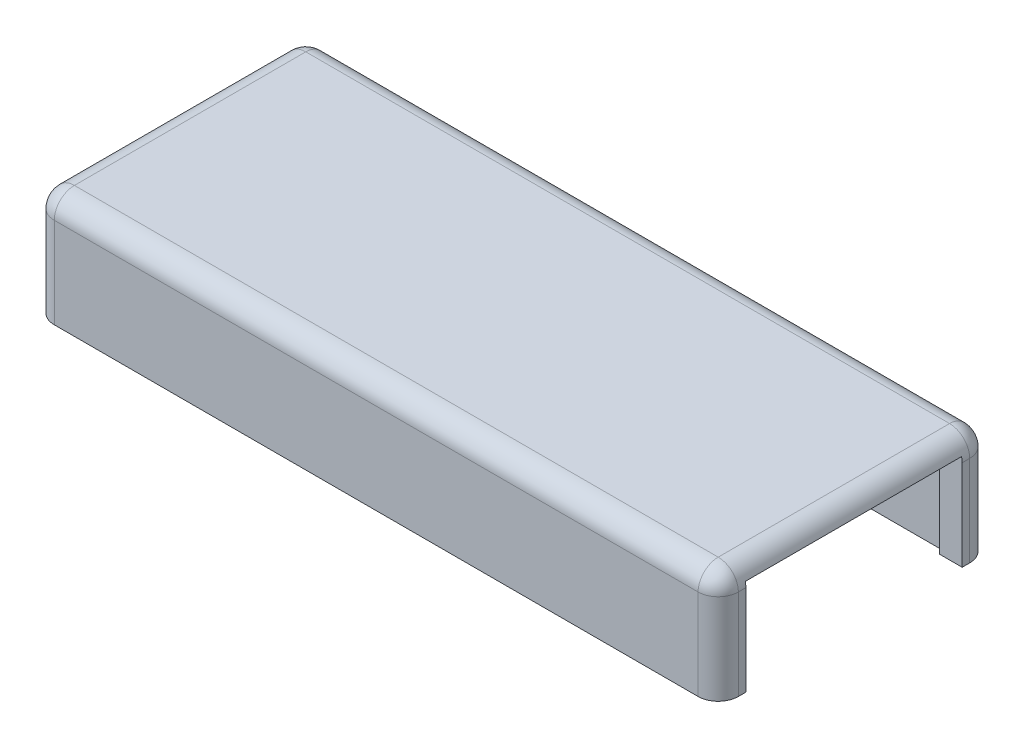
from build123d import *

# Parameters (mm, degrees)
SKETCH_1_W          = 68
SKETCH_1_H          = 27
EXTRUDE_1_DEPTH     = 11
SKETCH_2_W          = 63.5
SKETCH_2_H          = 22.5
CUT_EXTRUDE_1_DEPTH = 9.5
CUT_EXTRUDE_2_DEPTH = 2.25
SKETCH_4_W          = 21.5
SKETCH_4_H          = 9.5
CUT_EXTRUDE_3_DEPTH = 2.25
EXTRUDE_2_DEPTH     = 9.5
EXTRUDE_3_DEPTH     = 9.5
SKETCH_7_R          = 1
CUT_EXTRUDE_4_DEPTH = 9.5
FILLET_1_R          = 2


with BuildPart() as part:
    # Эскиз1 → Бобышка-Вытянуть1 (new body)
    with BuildSketch(Plane(origin=(0, 0, 0), x_dir=(1, 0, 0), z_dir=(0, 1, 0))):
        Rectangle(SKETCH_1_W, SKETCH_1_H)
    extrude(amount=EXTRUDE_1_DEPTH)

    # Эскиз2 → Вырез-Вытянуть1 (cut)
    with BuildSketch(Plane.XZ):
        Rectangle(SKETCH_2_W, SKETCH_2_H)
    extrude(amount=-CUT_EXTRUDE_1_DEPTH, mode=Mode.SUBTRACT)

    # Эскиз3 → Вырез-Вытянуть2 (cut)
    with BuildSketch(Plane.ZY.offset(34)):
        with BuildLine():
            Line((-4.6, 2.1), (-4.6, 0))
            Line((-4.6, 0), (4.6, 0))
            Line((4.6, 0), (4.6, 2.1))
            ThreePointArc((4.6, 2.1), (4.219238816, 3.019238816), (3.3, 3.4))
            Line((3.3, 3.4), (-3.3, 3.4))
            ThreePointArc((-3.3, 3.4), (-4.219238816, 3.019238816), (-4.6, 2.1))
        make_face()
    extrude(amount=-CUT_EXTRUDE_2_DEPTH, mode=Mode.SUBTRACT)

    # Эскиз4 → Вырез-Вытянуть3 (cut)
    with BuildSketch(Plane(origin=(34, 0, 0), x_dir=(0, 0, -1), z_dir=(1, 0, 0))):
        with Locations((0, 4.75)):
            Rectangle(SKETCH_4_W, SKETCH_4_H)
    extrude(amount=-CUT_EXTRUDE_3_DEPTH, mode=Mode.SUBTRACT)

    # Эскиз5 → Бобышка-Вытянуть2 (add)
    with BuildSketch(Plane.XZ.offset(-9.5)):
        with BuildLine():
            Line((-19.5, -9), (-19.5, -11.25))
            Line((-19.5, -11.25), (-23.5, -11.25))
            Line((-23.5, -11.25), (-23.5, -9))
            ThreePointArc((-23.5, -9), (-21.5, -7), (-19.5, -9))
        make_face()
        with BuildLine():
            Line((-23.5, 11.25), (-23.5, 9))
            ThreePointArc((-23.5, 9), (-21.5, 7), (-19.5, 9))
            Line((-19.5, 9), (-19.5, 11.25))
            Line((-19.5, 11.25), (-23.5, 11.25))
        make_face()
    extrude(amount=EXTRUDE_2_DEPTH)

    # Эскиз6 → Бобышка-Вытянуть3 (add)
    with BuildSketch(Plane.XZ.offset(-9.5)):
        with BuildLine():
            Line((23.7, -11), (23.7, -11.25))
            Line((23.7, -11.25), (22.3, -11.25))
            Line((22.3, -11.25), (22.3, -11))
            ThreePointArc((22.3, -11), (23, -10.3), (23.7, -11))
        make_face()
        with BuildLine():
            Line((22.3, 11.25), (22.3, 11))
            ThreePointArc((22.3, 11), (23, 10.3), (23.7, 11))
            Line((23.7, 11), (23.7, 11.25))
            Line((23.7, 11.25), (22.3, 11.25))
        make_face()
    extrude(amount=EXTRUDE_3_DEPTH)

    # Эскиз7 → Вырез-Вытянуть4 (cut)
    with BuildSketch(Plane.XZ):
        with Locations(Location((-21.5, -9, 0), (0, 0, 270))):
            Circle(SKETCH_7_R)
        with Locations(Location((-21.5, 9, 0), (0, 0, 270))):
            Circle(SKETCH_7_R)
    extrude(amount=-CUT_EXTRUDE_4_DEPTH, mode=Mode.SUBTRACT)

    # Скругление1
    # the kernel refuses this fillet: 2 mm, written as the material it takes off along each edge
    with BuildSketch(Plane(origin=(32, 9, -11.5), x_dir=(1, 0, 0), z_dir=(0, 0, -1))) as fillet_1_piece_1_section:
        Polygon((0, 0), (FILLET_1_R, 0), (FILLET_1_R, -FILLET_1_R), (0, -FILLET_1_R), align=None)
    fillet_1_piece_1 = extrude(amount=FILLET_1_R, mode=Mode.PRIVATE)
    fillet_1_piece_1 = fillet_1_piece_1 - Plane(origin=(32, 9, -11.5), x_dir=(-0.7071067811865475, -0.7071067811865475, 0), z_dir=(0, 0, -1)) * Sphere(FILLET_1_R, mode=Mode.PRIVATE)
    add(fillet_1_piece_1, mode=Mode.SUBTRACT)
    with BuildSketch(Plane(origin=(32, 9, 11.5), x_dir=(0, 0, 1), z_dir=(1, 0, 0))) as fillet_1_piece_2_section:
        Polygon((0, 0), (FILLET_1_R, 0), (FILLET_1_R, -FILLET_1_R), (0, -FILLET_1_R), align=None)
    fillet_1_piece_2 = extrude(amount=FILLET_1_R, mode=Mode.PRIVATE)
    fillet_1_piece_2 = fillet_1_piece_2 - Plane(origin=(32, 9, 11.5), x_dir=(0, -0.7071067811865475, -0.7071067811865475), z_dir=(1, 0, 0)) * Sphere(FILLET_1_R, mode=Mode.PRIVATE)
    add(fillet_1_piece_2, mode=Mode.SUBTRACT)
    with BuildSketch(Plane(origin=(-32, 9, 11.5), x_dir=(0, 0, 1), z_dir=(-1, 0, 0))) as fillet_1_piece_3_section:
        Polygon((0, 0), (FILLET_1_R, 0), (FILLET_1_R, FILLET_1_R), (0, FILLET_1_R), align=None)
    fillet_1_piece_3 = extrude(amount=FILLET_1_R, mode=Mode.PRIVATE)
    fillet_1_piece_3 = fillet_1_piece_3 - Plane(origin=(-32, 9, 11.5), x_dir=(0, -0.7071067811865475, -0.7071067811865475), z_dir=(-1, 0, 0)) * Sphere(FILLET_1_R, mode=Mode.PRIVATE)
    add(fillet_1_piece_3, mode=Mode.SUBTRACT)
    with BuildSketch(Plane(origin=(-32, 9, -11.5), x_dir=(-1, 0, 0), z_dir=(0, 0, -1))) as fillet_1_piece_4_section:
        Polygon((0, 0), (FILLET_1_R, 0), (FILLET_1_R, FILLET_1_R), (0, FILLET_1_R), align=None)
    fillet_1_piece_4 = extrude(amount=FILLET_1_R, mode=Mode.PRIVATE)
    fillet_1_piece_4 = fillet_1_piece_4 - Plane(origin=(-32, 9, -11.5), x_dir=(0.7071067811865475, -0.7071067811865475, 0), z_dir=(0, 0, -1)) * Sphere(FILLET_1_R, mode=Mode.PRIVATE)
    add(fillet_1_piece_4, mode=Mode.SUBTRACT)
    with BuildSketch(Plane(origin=(34, 11, -11.5), x_dir=(0, -1, 0), z_dir=(0, 0, 1)), Plane(origin=(-34, 11, 11.5), x_dir=(0, -1, 0), z_dir=(0, 0, -1))) as fillet_1_piece_5:
        with BuildLine():
            CenterArc((FILLET_1_R, -FILLET_1_R), FILLET_1_R, 90, 90)
            Line((0, -FILLET_1_R), (0, 0))
            Line((0, 0), (FILLET_1_R, 0))
        make_face()
    extrude(amount=23, mode=Mode.SUBTRACT)
    with BuildSketch(Plane(origin=(34, -5, 13.5), x_dir=(0, 0, -1), z_dir=(0, 1, 0)), Plane(origin=(34, -5, -13.5), x_dir=(-1, 0, 0), z_dir=(0, 1, 0))) as fillet_1_piece_6:
        with BuildLine():
            CenterArc((FILLET_1_R, FILLET_1_R), FILLET_1_R, 180, 90)
            Line((0, FILLET_1_R), (0, 0))
            Line((0, 0), (FILLET_1_R, 0))
        make_face()
    extrude(amount=14, mode=Mode.SUBTRACT)
    with BuildSketch(Plane(origin=(32, 11, 13.5), x_dir=(0, 0, -1), z_dir=(-1, 0, 0))) as fillet_1_piece_7:
        with BuildLine():
            CenterArc((FILLET_1_R, FILLET_1_R), FILLET_1_R, 180, 90)
            Line((0, FILLET_1_R), (0, 0))
            Line((0, 0), (FILLET_1_R, 0))
        make_face()
    extrude(amount=64, mode=Mode.SUBTRACT)
    with BuildSketch(Plane(origin=(-34, -5, 13.5), x_dir=(0, 0, -1), z_dir=(0, 1, 0)), Plane(origin=(-34, -5, -13.5), x_dir=(1, 0, 0), z_dir=(0, 1, 0))) as fillet_1_piece_8:
        with BuildLine():
            CenterArc((FILLET_1_R, -FILLET_1_R), FILLET_1_R, 90, 90)
            Line((0, -FILLET_1_R), (0, 0))
            Line((0, 0), (FILLET_1_R, 0))
        make_face()
    extrude(amount=14, mode=Mode.SUBTRACT)
    with BuildSketch(Plane(origin=(-32, 11, -13.5), x_dir=(0, -1, 0), z_dir=(1, 0, 0))) as fillet_1_piece_9:
        with BuildLine():
            CenterArc((FILLET_1_R, -FILLET_1_R), FILLET_1_R, 90, 90)
            Line((0, -FILLET_1_R), (0, 0))
            Line((0, 0), (FILLET_1_R, 0))
        make_face()
    extrude(amount=64, mode=Mode.SUBTRACT)


solid = part.part
